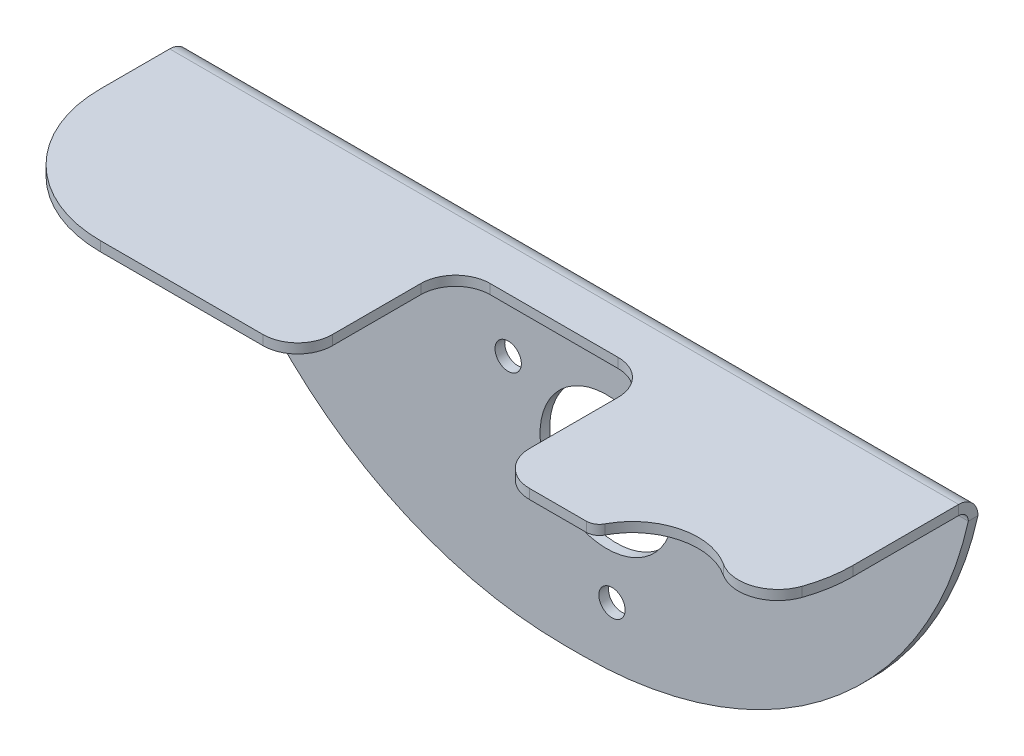
from build123d import *

# Parameters (mm, degrees)
BASE_FLANGE1_DEPTH = 0.7366
EDGE_FLANGE1_DEPTH = 60
SKETCH10_R         = 1
CUT_EXTRUDE1_DEPTH = 10
SKETCH11_R         = 4.999999998
CUT_EXTRUDE2_DEPTH = 10
FILLET1_START      = -9.2366
FILLET1_DEPTH      = 0.7366
FILLET2_R          = 10
FILLET3_R          = 10
FILLET4_R          = 3
FILLET5_R          = 1
SKETCH14_R         = 5.07
SKETCH14_R_2       = 4.97
CUT_EXTRUDE4_DEPTH = 0.7366


with BuildPart() as part:
    # Base-Flange1: sheet metal written as solids
    # Sketch2 → Base-Flange1 (new body)
    with BuildSketch(Plane(origin=(0, 0, 0), x_dir=(1, 0, 0), z_dir=(0, 1, 0))):
        with BuildLine():
            Line((-2.36642583, 4.5), (7.36642583, 4.5))
            ThreePointArc((7.36642583, 4.5), (9.228643984, 3.728643984), (10, 1.86642583))
            Line((10, 1.86642583), (10, -4.86642583))
            ThreePointArc((10, -4.86642583), (10.771356016, -6.728643984), (12.63357417, -7.5))
            Line((12.63357417, -7.5), (30, -7.5))
            Line((30, -7.5), (30, 7.5))
            Line((30, 7.5), (-30, 7.5))
            Line((-30, 7.5), (-30, -7.5))
            Line((-30, -7.5), (-7.63357417, -7.5))
            ThreePointArc((-7.63357417, -7.5), (-5.771356016, -6.728643984), (-5, -4.86642583))
            Line((-5, -4.86642583), (-5, 1.86642583))
            ThreePointArc((-5, 1.86642583), (-4.228643984, 3.728643984), (-2.36642583, 4.5))
        make_face()
    extrude(amount=-BASE_FLANGE1_DEPTH)

    # Edge-Flange1: sheet metal written as solids
    # Edge-Flange1 section (on a plane across the edge) → Edge-Flange1 (add)
    with BuildSketch(Plane(origin=(-30, -0.7366, -8.5), x_dir=(0, 0, 1), z_dir=(1, 0, 0))):
        with BuildLine():
            Line((-0.7366, 0.7366), (-0.7366, 24.2634))
            Line((-0.7366, 24.2634), (0, 24.2634))
            Line((0, 24.2634), (0, 0.7366))
            ThreePointArc((0, 0.7366), (0.215745145, 0.215745145), (0.7366, 0))
            Line((0.7366, 0), (1, 0))
            Line((1, 0), (1, -0.7366))
            Line((1, -0.7366), (0.7366, -0.7366))
            ThreePointArc((0.7366, -0.7366), (-0.30510971, -0.30510971), (-0.7366, 0.7366))
        make_face()
    extrude(amount=EDGE_FLANGE1_DEPTH)

    # Sketch10 → Cut-Extrude1 (cut)
    with BuildSketch(Plane(origin=(0, 0, -9.2366), x_dir=(-1, 0, 0), z_dir=(0, 0, -1))):
        with Locations(Location((-9.590779371, -7.407129747, 0), (0, 0, 90))):
            Circle(SKETCH10_R)
        with Locations(Location((4.992621112, -8.103140058, 0), (0, 0, 90))):
            Circle(SKETCH10_R)
        with Locations(Location((-2.90184174, -20.384730194, 0), (0, 0, 90))):
            Circle(SKETCH10_R)
    extrude(amount=-CUT_EXTRUDE1_DEPTH, mode=Mode.SUBTRACT)

    # Sketch11 → Cut-Extrude2 (cut)
    with BuildSketch(Plane.XZ.offset(0.7366)):
        with Locations((22.255915642, 9.300009257)):
            Circle(SKETCH11_R)
    extrude(amount=-CUT_EXTRUDE2_DEPTH, mode=Mode.SUBTRACT)

    # Fillet1: read off the stored shape, not the designer's step
    # Fillet1 outline → Fillet1 (cut)
    with BuildSketch(Plane.XY.offset(FILLET1_START)):
        with BuildLine():
            ThreePointArc((30, -1.4732), (19.492381656, -18.390126122), (0.706695616, -25))
            Line((0.706695616, -25), (30, -25))
            Line((30, -25), (30, -1.4732))
        make_face()
        with BuildLine():
            ThreePointArc((-0.706695616, -25), (-19.492381656, -18.390126122), (-30, -1.4732))
            Line((-30, -1.4732), (-30, -25))
            Line((-30, -25), (-0.706695616, -25))
        make_face()
    extrude(amount=FILLET1_DEPTH, mode=Mode.SUBTRACT)

    # Fillet2
    fillet2_edges = [part.edges().sort_by_distance(p)[0] for p in [
        (-30, -0.3683, 7.5),
    ]]
    fillet(fillet2_edges, radius=FILLET2_R)

    # Fillet3
    # the kernel refuses this fillet: 10 mm, written as the material it takes off along each edge
    with BuildSketch(Plane(origin=(30, 18.045823122, 7.5), x_dir=(0, 0, -1), z_dir=(0, -1, 0))) as fillet3_piece_1:
        with BuildLine():
            CenterArc((7.218329249, -10), FILLET3_R, 90, 46.206018187)
            Line((0, -3.079326416), (-0.144366585, -2.940912944))
            ThreePointArc((-0.144366585, -2.940912944), (-0.2, -1.539663208), (-0.2, 0))
            Line((-0.2, 0), (0, 0.2))
            Line((0, 0.2), (7.218329249, 0.2))
            Line((7.218329249, 0.2), (7.218329249, 0))
        make_face()
    extrude(amount=36.828246244, mode=Mode.SUBTRACT)

    # Fillet4
    fillet4_edges = [part.edges().sort_by_distance(p)[0] for p in [
        (26.920673584, -0.3683, 7.5),
    ]]
    fillet(fillet4_edges, radius=FILLET4_R)

    # Fillet5
    fillet5_edges = [part.edges().sort_by_distance(p)[0] for p in [
        (17.5911577, -0.3683, 7.5),
    ]]
    fillet(fillet5_edges, radius=FILLET5_R)

    # Sketch14 → Cut-Extrude4 (cut)
    # profile 1 of 2: a face of its own
    with BuildSketch(Plane.XY.offset(-8.5)):
        with Locations((2.5, -11.965)):
            Circle(SKETCH14_R)
        with Locations((2.5, -11.965)):
            Circle(SKETCH14_R_2, mode=Mode.SUBTRACT)
    # profile 2 of 2: a face of its own
    with BuildSketch(Plane.XY.offset(-8.5)):
        with Locations((2.5, -11.965)):
            Circle(SKETCH14_R_2)
    extrude(amount=-CUT_EXTRUDE4_DEPTH, mode=Mode.SUBTRACT)


solid = part.part
